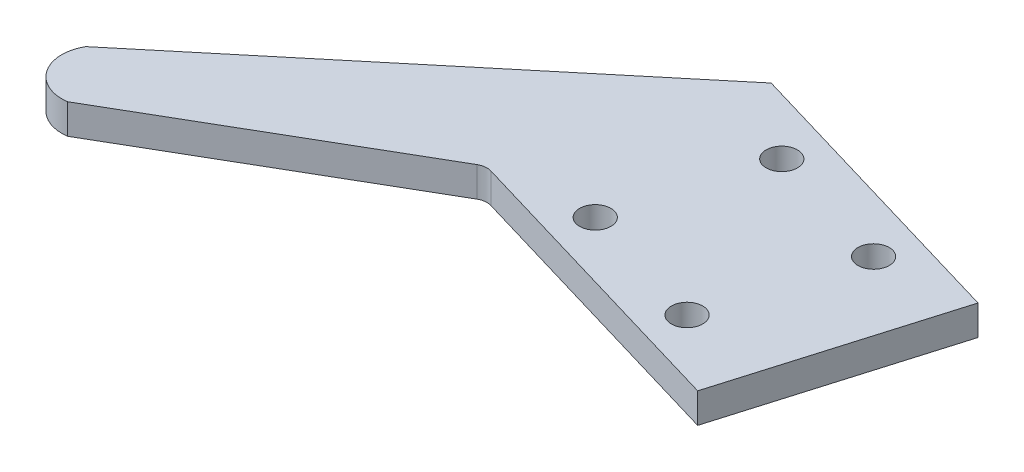
from build123d import *

# Parameters (mm, degrees)
BOSS_EXTRUDE1_DEPTH    = 4.7625
F_10_CLEARANCE_HOLE1_D = 4.9784


with BuildPart() as part:
    # Sketch1 → Boss-Extrude1 (new body)
    with BuildSketch(Plane(origin=(0, 0, 0), x_dir=(1, 0, 0), z_dir=(0, 1, 0))):
        with BuildLine():
            Line((22.994624733, -31.524992416), (-18.204730368, -55.415445829))
            ThreePointArc((-18.204730368, -55.415445829), (-24.10202239, -52.817624121), (-24.351569793, -46.378334027))
            Line((-24.351569793, -46.378334027), (35.179941753, 3.113165809))
            Line((35.179941753, 3.113165809), (81.92289285, -10.7327271))
            Line((81.92289285, -10.7327271), (71.73313232, -45.132782137))
            Line((71.73313232, -45.132782137), (24.990181224, -31.286889228))
            ThreePointArc((24.990181224, -31.286889228), (23.967852385, -31.200180886), (22.994624733, -31.524992416))
        make_face()
    extrude(amount=BOSS_EXTRUDE1_DEPTH)

    # #10 Clearance Hole1 (through all)
    with Locations(Plane(origin=(0, 4.7625, 0), x_dir=(1, 0, 0), z_dir=(0, 1, 0))):
        with Locations((39.691148793, -29.383038523), (46.472299163, -6.490258533), (67.221925281, -12.636577805), (60.440774911, -35.529357795)):
            Hole(F_10_CLEARANCE_HOLE1_D / 2)


solid = part.part
